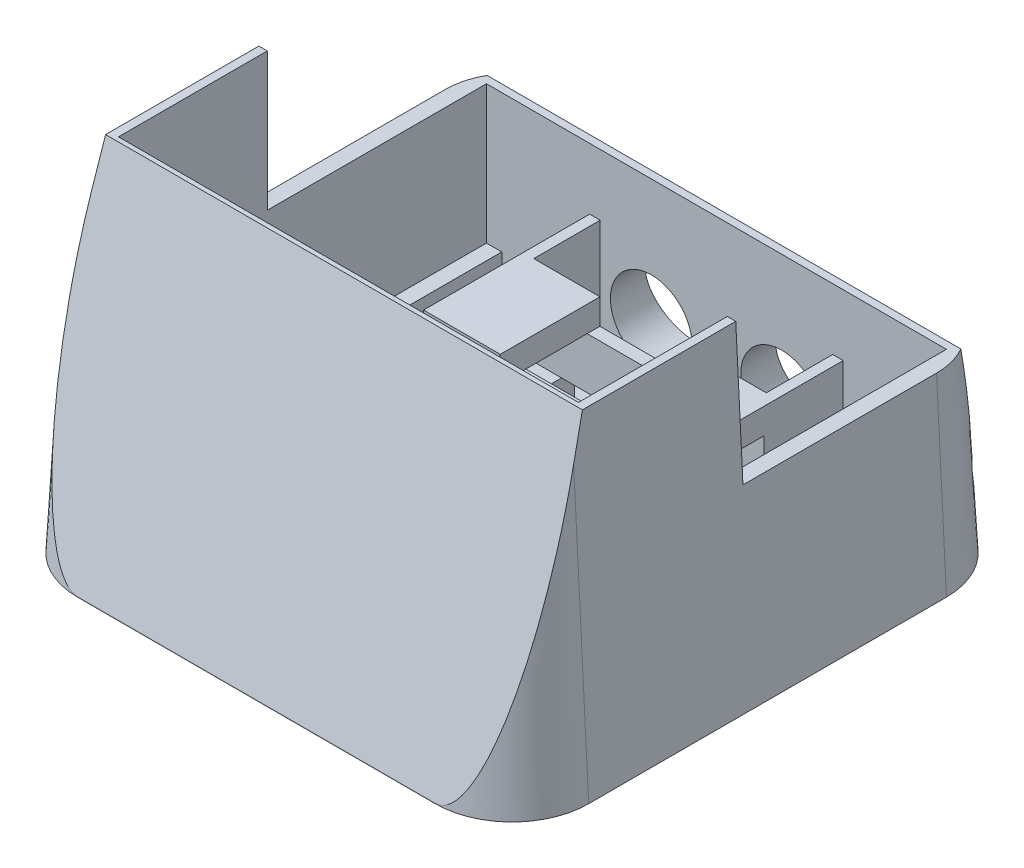
from build123d import *

# Parameters (mm, degrees)
BOSS_EXTRUDE1_DEPTH     = 10
SKETCH2_W               = 17.2
SKETCH2_H               = 43
CUT_EXTRUDE1_DEPTH      = 72.414284285
SKETCH3_W               = 90
SKETCH3_H               = 34
SKETCH3_W_2             = 80
SKETCH3_H_2             = 24
BOSS_EXTRUDE3_DEPTH     = 15
SKETCH4_W               = 49.6
SKETCH4_H               = 5
BOSS_EXTRUDE4_DEPTH     = 10
SKETCH5_W               = 15
SKETCH5_H               = 22
BOSS_EXTRUDE5_DEPTH     = 5
SKETCH6_W               = 90
SKETCH6_H               = 77
BOSS_EXTRUDE6_DEPTH     = 15
BOSS_EXTRUDE8_DEPTH     = 39
CHAMFER1_SIZE           = 64
CHAMFER1_SIZE_2         = 3.354097874
CHAMFER2_SIZE           = 64
CHAMFER2_SIZE_2         = 11.405813635
CHAMFER3_SIZE           = 64
CHAMFER3_SIZE_2         = 13.775745352
CUT_EXTRUDE3_DEPTH      = 95.500525601
CUT_EXTRUDE3_DEPTH_BACK = 95.500525601
SKETCH10_W              = 50
SKETCH10_H              = 27
SKETCH11_W              = 45.5
SKETCH11_H              = 10.5
CUT_EXTRUDE4_DEPTH      = 7.5
SKETCH14_W              = 2.05
SKETCH14_H              = 10.5
BOSS_EXTRUDE9_DEPTH     = 15
SKETCH15_R              = 8
CUT_EXTRUDE5_DEPTH      = 122.227059686
CUT_EXTRUDE6_DEPTH      = 2.5
CUT_EXTRUDE7_REACH      = 97.373
SKETCH18_W              = 29.6
SKETCH18_H              = 45
CUT_EXTRUDE8_DEPTH      = 15
SKETCH21_W              = 29.6
SKETCH21_H              = 35
BOSS_EXTRUDE10_DEPTH    = 2.5


with BuildPart() as part:
    # Sketch1 → Boss-Extrude1 (new body)
    with BuildSketch(Plane(origin=(0, 0, 0), x_dir=(1, 0, 0), z_dir=(0, 1, 0))):
        with BuildLine():
            Line((-35, 50), (35, 50))
            ThreePointArc((35, 50), (45.606601718, 45.606601718), (50, 35))
            Line((50, 35), (50, -35))
            ThreePointArc((50, -35), (45.606601718, -45.606601718), (35, -50))
            Line((35, -50), (-35, -50))
            ThreePointArc((-35, -50), (-45.606601718, -45.606601718), (-50, -35))
            Line((-50, -35), (-50, 35))
            ThreePointArc((-50, 35), (-45.606601718, 45.606601718), (-35, 50))
        make_face()
    extrude(amount=BOSS_EXTRUDE1_DEPTH)

    # Sketch2 → Cut-Extrude1 (cut, through all)
    with BuildSketch(Plane(origin=(0, 10, 0), x_dir=(1, 0, 0), z_dir=(0, 1, 0))):
        with Locations((-33.4, 18.5)):
            Rectangle(SKETCH2_W, SKETCH2_H)
        with Locations((33.4, 18.5)):
            Rectangle(SKETCH2_W, SKETCH2_H)
    extrude(amount=-CUT_EXTRUDE1_DEPTH, mode=Mode.SUBTRACT)

    # Sketch3 → Boss-Extrude3 (add)
    with BuildSketch(Plane(origin=(0, 10, 0), x_dir=(1, 0, 0), z_dir=(0, 1, 0))):
        with Locations((0, -20)):
            Rectangle(SKETCH3_W, SKETCH3_H)
        with Locations((0, -20)):
            Rectangle(SKETCH3_W_2, SKETCH3_H_2, mode=Mode.SUBTRACT)
    extrude(amount=BOSS_EXTRUDE3_DEPTH)

    # Sketch4 → Boss-Extrude4 (add)
    with BuildSketch(Plane(origin=(0, 10, 0), x_dir=(1, 0, 0), z_dir=(0, 1, 0))):
        with Locations((0, 10)):
            Rectangle(SKETCH4_W, SKETCH4_H)
        with Locations((0, 27)):
            Rectangle(SKETCH4_W, SKETCH4_H)
    extrude(amount=BOSS_EXTRUDE4_DEPTH)

    # Sketch5 → Boss-Extrude5 (add)
    with BuildSketch(Plane(origin=(0, 20, 0), x_dir=(1, 0, 0), z_dir=(0, 1, 0))):
        with Locations((-17.3, 18.5)):
            Rectangle(SKETCH5_W, SKETCH5_H)
        with Locations((17.3, 18.5)):
            Rectangle(SKETCH5_W, SKETCH5_H)
    extrude(amount=BOSS_EXTRUDE5_DEPTH)

    # Sketch6 → Boss-Extrude6 (add)
    with BuildSketch(Plane(origin=(0, 10, 0), x_dir=(1, 0, 0), z_dir=(0, 1, 0))):
        with BuildLine():
            Line((-50, 35), (-50, -35))
            ThreePointArc((-50, -35), (-45.606601718, -45.606601718), (-35, -50))
            Line((-35, -50), (35, -50))
            ThreePointArc((35, -50), (45.606601718, -45.606601718), (50, -35))
            Line((50, -35), (50, 35))
            ThreePointArc((50, 35), (45.606601718, 45.606601718), (35, 50))
            Line((35, 50), (-35, 50))
            ThreePointArc((-35, 50), (-45.606601718, 45.606601718), (-50, 35))
        make_face()
        with Locations((0, 1.5)):
            Rectangle(SKETCH6_W, SKETCH6_H, mode=Mode.SUBTRACT)
    extrude(amount=BOSS_EXTRUDE6_DEPTH)

    # Sketch9 → Boss-Extrude8 (add)
    with BuildSketch(Plane(origin=(0, 25, 0), x_dir=(1, 0, 0), z_dir=(0, 1, 0))):
        with BuildLine():
            Line((-50, 35), (-50, -35))
            ThreePointArc((-50, -35), (-45.606601718, -45.606601718), (-35, -50))
            Line((-35, -50), (35, -50))
            ThreePointArc((35, -50), (45.606601718, -45.606601718), (50, -35))
            Line((50, -35), (50, 35))
            ThreePointArc((50, 35), (45.606601718, 45.606601718), (35, 50))
            Line((35, 50), (-35, 50))
            ThreePointArc((-35, 50), (-45.606601718, 45.606601718), (-50, 35))
        make_face()
        with BuildLine():
            Line((-45, 35), (-45, -32))
            Line((-45, -32), (45, -32))
            Line((45, -32), (45, 35))
            ThreePointArc((45, 35), (44.659258263, 37.588190451), (43.660254038, 40))
            Line((43.660254038, 40), (-43.660254038, 40))
            ThreePointArc((-43.660254038, 40), (-44.659258263, 37.588190451), (-45, 35))
        make_face(mode=Mode.SUBTRACT)
    extrude(amount=BOSS_EXTRUDE8_DEPTH)

    # Chamfer1
    # the kernel refuses this chamfer: 64, 3.354097874 mm, written as the material it takes off along each edge
    with BuildSketch(Plane(origin=(-35, 64, 50), x_dir=(0, -0.9999979738662979, 0.002013023422382214), z_dir=(1, 0, 0)), Plane(origin=(50, 64, 35), x_dir=(0.002013023422382214, -0.9999979738662979, 0), z_dir=(0, 0, -1)), Plane(origin=(-50, 64, -35), x_dir=(-0.002013023422382214, -0.9999979738662979, 0), z_dir=(0, 0, 1)), Plane(origin=(35, 64, -50), x_dir=(0, -0.9999979738662979, -0.002013023422382214), z_dir=(-1, 0, 0))) as chamfer1_piece_1:
        Polygon((CHAMFER1_SIZE * 0.999997973866, CHAMFER1_SIZE * 0.00201302342238), (-CHAMFER1_SIZE_2 * 0.00201302342245, CHAMFER1_SIZE_2 * 0.9999979739), (0, 0), align=None)
    extrude(amount=70, mode=Mode.SUBTRACT)
    with BuildSketch(Plane(origin=(35, 64, 35), x_dir=(0, 0, 1), z_dir=(-1, 0, 0))) as chamfer1_piece_2:
        Polygon((15, -CHAMFER1_SIZE), (15 - CHAMFER1_SIZE_2, 0), (15, 0), align=None)
    revolve(axis=Axis((35, 64, 35), (0, 1, 0)), revolution_arc=90, mode=Mode.SUBTRACT)
    with BuildSketch(Plane(origin=(-35, 64, 35), x_dir=(-1, 0, 0), z_dir=(0, 0, -1))) as chamfer1_piece_3:
        Polygon((15, -CHAMFER1_SIZE), (15 - CHAMFER1_SIZE_2, 0), (15, 0), align=None)
    revolve(axis=Axis((-35, 64, 35), (0, 1, 0)), revolution_arc=90, mode=Mode.SUBTRACT)
    with BuildSketch(Plane(origin=(35, 64, -35), x_dir=(1, 0, 0), z_dir=(0, 0, 1))) as chamfer1_piece_4:
        Polygon((15, -CHAMFER1_SIZE), (15 - CHAMFER1_SIZE_2, 0), (15, 0), align=None)
    revolve(axis=Axis((35, 64, -35), (0, 1, 0)), revolution_arc=90, mode=Mode.SUBTRACT)
    with BuildSketch(Plane(origin=(-35, 64, -35), x_dir=(0, 0, -1), z_dir=(1, 0, 0))) as chamfer1_piece_5:
        Polygon((15 - CHAMFER1_SIZE_2, 0), (15, -CHAMFER1_SIZE), (15, 0), align=None)
    revolve(axis=Axis((-35, 64, -35), (0, 1, 0)), revolution_arc=90, mode=Mode.SUBTRACT)

    # Chamfer2
    # the kernel refuses this chamfer: 64, 11.405813635 mm, written as the material it takes off along each edge
    with BuildSketch(Plane(origin=(201.306482971, 64, -46.645902126), x_dir=(0, -0.9982575003065525, -0.05900816114499234), z_dir=(-1, 0, 0))) as chamfer2_piece_1:
        Polygon((CHAMFER2_SIZE * 0.999977671636, CHAMFER2_SIZE * 0.0066825316561), (-CHAMFER2_SIZE_2 * 0.0590081611462, CHAMFER2_SIZE_2 * 0.998257500326), (0, 0), align=None)
    extrude(amount=402.612965942, mode=Mode.SUBTRACT)

    # Chamfer3
    # the kernel refuses this chamfer: 64, 13.775745352 mm, written as the material it takes off along each edge
    with BuildSketch(Plane(origin=(-201.265469314, 64, 46.645902126), x_dir=(0, -0.9981787050157903, 0.06032638604292662), z_dir=(1, 0, 0))) as chamfer3_piece_1:
        Polygon((CHAMFER3_SIZE * 0.999967974892, CHAMFER3_SIZE * 0.00800307379952), (-CHAMFER3_SIZE_2 * 0.060326386045, CHAMFER3_SIZE_2 * 0.99817870505), (0, 0), align=None)
    extrude(amount=402.530938629, mode=Mode.SUBTRACT)

    # Sketch10 → Cut-Extrude3 (cut, two sides: drawn at the far end of the back side and taken through both)
    with BuildSketch(Plane(origin=(0, 1.307501734, 0), x_dir=(0, 0, 1), z_dir=(-1, 0, 0)).offset(-CUT_EXTRUDE3_DEPTH_BACK)):
        with Locations((-22.129843227, 49.192498266)):
            Rectangle(SKETCH10_W, SKETCH10_H)
    extrude(amount=CUT_EXTRUDE3_DEPTH + CUT_EXTRUDE3_DEPTH_BACK, mode=Mode.SUBTRACT)

    # Sketch11 → Cut-Extrude4 (cut)
    with BuildSketch(Plane(origin=(0, 10, 0), x_dir=(1, 0, 0), z_dir=(0, 1, 0))):
        with Locations((0, 34.75)):
            Rectangle(SKETCH11_W, SKETCH11_H)
    extrude(amount=-CUT_EXTRUDE4_DEPTH, mode=Mode.SUBTRACT)

    # Sketch14 → Boss-Extrude9 (add)
    with BuildSketch(Plane(origin=(0, 10, 0), x_dir=(1, 0, 0), z_dir=(0, 1, 0))):
        with Locations((-23.775, 34.75)):
            Rectangle(SKETCH14_W, SKETCH14_H)
        with Locations((23.775, 34.75)):
            Rectangle(SKETCH14_W, SKETCH14_H)
    extrude(amount=BOSS_EXTRUDE9_DEPTH)

    # Sketch15 → Cut-Extrude5 (cut, through all)
    with BuildSketch(Plane.XY.offset(-40)):
        with Locations((-12.75, 12.75)):
            Circle(SKETCH15_R)
        with Locations((12.75, 12.75)):
            Circle(SKETCH15_R)
    extrude(amount=-CUT_EXTRUDE5_DEPTH, mode=Mode.SUBTRACT)

    # Sketch17 → Cut-Extrude6 (cut)
    with BuildSketch(Plane(origin=(0, 0, -29.5), x_dir=(-1, 0, 0), z_dir=(0, 0, -1))):
        Polygon((-9.8, 25), (-22.75, 25), (-22.75, 2.5), (22.75, 2.5), (22.75, 25), (9.8, 25), (9.8, 20), (-9.8, 20), align=None)
    extrude(amount=-CUT_EXTRUDE6_DEPTH, mode=Mode.SUBTRACT)

    # Cut-Extrude7: up to this face of the body (flat: up to its plane)
    cut_extrude7_end = Plane(part.part.faces().sort_by_distance((0, 10, -18.5))[0])
    # Sketch18 → Cut-Extrude7 (cut, up to the picked face)
    with BuildSketch(Plane.XZ, mode=Mode.PRIVATE) as cut_extrude7_sk1:
        with Locations((0, -4.5)):
            Rectangle(SKETCH18_W, SKETCH18_H)
    cut_extrude7_tool1 = split(extrude(cut_extrude7_sk1.sketch, amount=-CUT_EXTRUDE7_REACH, mode=Mode.PRIVATE), bisect_by=cut_extrude7_end, keep=Keep.BOTH, mode=Mode.PRIVATE)
    add(cut_extrude7_tool1.solids().sort_by(Axis((0, 0, -4.5), (0, 1, 0)))[0], mode=Mode.SUBTRACT)

    # Sketch20 → Cut-Extrude8 (cut)
    with BuildSketch(Plane.XZ.offset(-25)):
        with BuildLine():
            Line((-45, -35), (-45, -40))
            Line((-45, -40), (-43.660254038, -40))
            ThreePointArc((-43.660254038, -40), (-44.659258263, -37.588190451), (-45, -35))
        make_face()
        with BuildLine():
            Line((45, -40), (45, -35))
            ThreePointArc((45, -35), (44.659258263, -37.588190451), (43.660254038, -40))
            Line((43.660254038, -40), (45, -40))
        make_face()
    extrude(amount=-CUT_EXTRUDE8_DEPTH, mode=Mode.SUBTRACT)

    # Sketch21 → Boss-Extrude10 (add)
    with BuildSketch(Plane.XZ):
        with Locations((0, 0.5)):
            Rectangle(SKETCH21_W, SKETCH21_H)
    extrude(amount=-BOSS_EXTRUDE10_DEPTH)


solid = part.part
